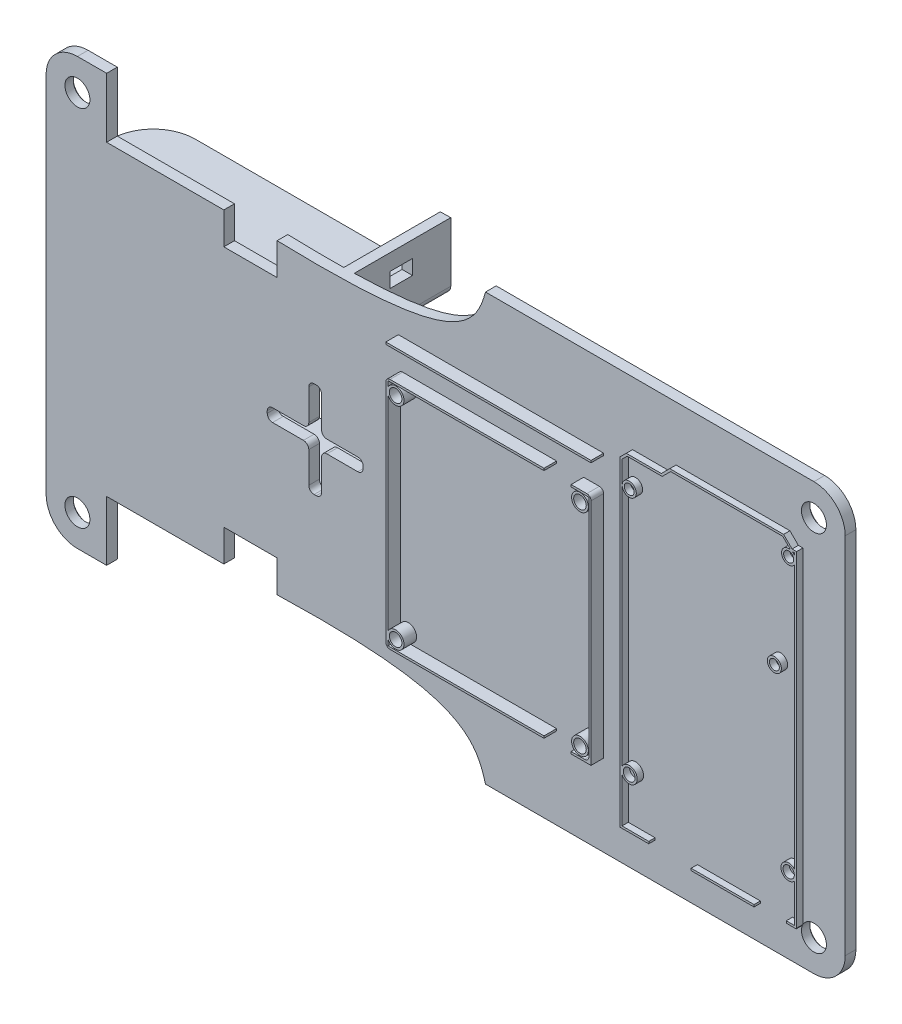
from build123d import *

# Parameters (mm, degrees)
SKETCH1_W                                  = 190.5
SKETCH1_H                                  = 101.6
BOSS_EXTRUDE1_DEPTH                        = 2.54
CUT_EXTRUDE1_DEPTH                         = 108.979878218
FILLET1_R                                  = 7.46
CUT_EXTRUDE2_DEPTH                         = 108.979878356
BOSS_EXTRUDE2_DEPTH                        = 23
SKETCH6_W                                  = 5.32067848
SKETCH6_H                                  = 3.518384052
CUT_EXTRUDE4_DEPTH                         = 132.98228537
FILLET3_R                                  = 1.778
SKETCH5_R                                  = 3.175
CUT_EXTRUDE3_DEPTH                         = 129.654217872
SKETCH7_R                                  = 1.905
SKETCH7_W                                  = 22.4
SKETCH7_H                                  = 22.4
SKETCH7_R_2                                = 3.00715076
BOSS_EXTRUDE4_DEPTH                        = 2.54
SKETCH9_R                                  = 1.397
CUT_EXTRUDE5_DEPTH                         = 1.27
EXTRUDE_THIN1_OUTLINE_R                    = 1.683258174
EXTRUDE_THIN1_OUTLINE_R_2                  = 1.183258174
EXTRUDE_THIN1_OUTLINE_R_3                  = 1.678128829
EXTRUDE_THIN1_OUTLINE_R_4                  = 1.178128829
EXTRUDE_THIN1_OUTLINE_W                    = 14.997012947
EXTRUDE_THIN1_OUTLINE_H                    = 0.5
EXTRUDE_THIN1_OUTLINE_R_5                  = 1.416116328
EXTRUDE_THIN1_OUTLINE_R_6                  = 1.354095782
EXTRUDE_THIN1_OUTLINE_R_7                  = 1.201329703
EXTRUDE_THIN1_DEPTH                        = 1.5
F_15_64_0_23438_DIAMETER_HOLE1_D           = 5.953252
F_15_64_0_23438_DIAMETER_HOLE1_CSINK_D     = 7.223252
F_15_64_0_23438_DIAMETER_HOLE1_CSINK_ANGLE = 100
EXTRUDE_THIN2_OUTLINE_W                    = 48.917101996
EXTRUDE_THIN2_OUTLINE_H                    = 0.5
EXTRUDE_THIN2_OUTLINE_R                    = 1.5
EXTRUDE_THIN2_OUTLINE_R_2                  = 2
EXTRUDE_THIN2_DEPTH                        = 3
FILLET4_R                                  = 1
FILLET5_R                                  = 10
FILLET6_R                                  = 2


# Read off the part's stored shape, not the designer's step: Extrude-Thin1, Extrude-Thin2
with BuildPart() as part:
    # Sketch1 → Boss-Extrude1 (new body)
    with BuildSketch(Plane.XY):
        Rectangle(SKETCH1_W, SKETCH1_H)
    extrude(amount=BOSS_EXTRUDE1_DEPTH)

    # Sketch2 → Cut-Extrude1 (cut, through all)
    with BuildSketch(Plane.XY.offset(2.54)):
        with BuildLine():
            Line((-80.828024073, 62.685762119), (-80.828024073, 36.556311377))
            Line((-80.828024073, 36.556311377), (-52.888024073, 36.556311377))
            Line((-52.888024073, 36.556311377), (-52.888024073, 28.936311377))
            Line((-52.888024073, 28.936311377), (-40.188024073, 28.936311377))
            Line((-40.188024073, 28.936311377), (-40.188024073, 36.556311377))
            add(Edge.make_bspline(
                [(-40.188024073, 36.556311377), (16.484036857, 34.92619245), (6.482116837, 46.779443168), (12.522491122, 62.685762119)],
                knots=[0, 0, 0, 0, 0.808428904, 0.808428904, 0.808428904, 0.808428904], degree=3))
            Line((12.522491122, 62.685762119), (-80.828024073, 62.685762119))
        make_face()
    cut_extrude1 = extrude(amount=-CUT_EXTRUDE1_DEPTH, mode=Mode.SUBTRACT)

    # Mirror1: Cut-Extrude1 across plane
    add(cut_extrude1.mirror(Plane.ZX), mode=Mode.SUBTRACT)

    # Fillet1
    fillet1_edges = [part.edges().sort_by_distance(p)[0] for p in [
        (-95.25, 50.8, 1.27),
        (95.25, 50.8, 1.27),
        (95.25, -50.8, 1.27),
        (-95.25, -50.8, 1.27),
    ]]
    fillet(fillet1_edges, radius=FILLET1_R)

    # Sketch3 → Cut-Extrude2 (cut, through all)
    with BuildSketch(Plane(origin=(0, 0, 0), x_dir=(-1, 0, 0), z_dir=(0, 0, -1))):
        with BuildLine():
            Line((32.633416048, 2.794), (32.633416048, 10.16))
            ThreePointArc((32.633416048, 10.16), (32.26144166, 11.058025612), (31.363416048, 11.43))
            Line((31.363416048, 11.43), (30.855416048, 11.43))
            ThreePointArc((30.855416048, 11.43), (29.957390436, 11.058025612), (29.585416048, 10.16))
            Line((29.585416048, 10.16), (29.585416048, 2.794))
            ThreePointArc((29.585416048, 2.794), (29.21344166, 1.895974388), (28.315416048, 1.524))
            Line((28.315416048, 1.524), (20.949416048, 1.524))
            ThreePointArc((20.949416048, 1.524), (20.051390436, 1.152025612), (19.679416048, 0.254))
            Line((19.679416048, 0.254), (19.679416048, -0.254))
            ThreePointArc((19.679416048, -0.254), (20.051390436, -1.152025612), (20.949416048, -1.524))
            Line((20.949416048, -1.524), (28.315416048, -1.524))
            ThreePointArc((28.315416048, -1.524), (29.21344166, -1.895974388), (29.585416048, -2.794))
            Line((29.585416048, -2.794), (29.585416048, -10.16))
            ThreePointArc((29.585416048, -10.16), (29.957390436, -11.058025612), (30.855416048, -11.43))
            Line((30.855416048, -11.43), (31.363416048, -11.43))
            ThreePointArc((31.363416048, -11.43), (32.26144166, -11.058025612), (32.633416048, -10.16))
            Line((32.633416048, -10.16), (32.633416048, -2.794))
            ThreePointArc((32.633416048, -2.794), (33.005390436, -1.895974388), (33.903416048, -1.524))
            Line((33.903416048, -1.524), (41.269416048, -1.524))
            ThreePointArc((41.269416048, -1.524), (42.16744166, -1.152025612), (42.539416048, -0.254))
            Line((42.539416048, -0.254), (42.539416048, 0.254))
            ThreePointArc((42.539416048, 0.254), (42.16744166, 1.152025612), (41.269416048, 1.524))
            Line((41.269416048, 1.524), (33.903416048, 1.524))
            ThreePointArc((33.903416048, 1.524), (33.005390436, 1.895974388), (32.633416048, 2.794))
        make_face()
    extrude(amount=-CUT_EXTRUDE2_DEPTH, mode=Mode.SUBTRACT)

    # Sketch4 → Boss-Extrude2 (add)
    with BuildSketch(Plane(origin=(0, 0, 0), x_dir=(-1, 0, 0), z_dir=(0, 0, -1))):
        with BuildLine():
            add(Edge.make_bspline(
                [(26.830619379, 36.431168354), (25.975127906, 36.443330167), (25.140496739, 36.459933722), (24.326182366, 36.480917053)],
                knots=[0.07048369, 0.07048369, 0.07048369, 0.07048369, 0.085625626, 0.085625626, 0.085625626, 0.085625626], degree=3))
            Line((24.326182366, 36.480917053), (24.326182366, 20.536114351))
            Line((24.326182366, 20.536114351), (95.25, 20.536114351))
            Line((95.25, 20.536114351), (95.25, 22.233100208))
            Line((95.25, 22.233100208), (26.830619379, 22.233100208))
            Line((26.830619379, 22.233100208), (26.830619379, 36.431168354))
        make_face()
    boss_extrude2 = extrude(amount=BOSS_EXTRUDE2_DEPTH)

    # Sketch6 → Cut-Extrude4 (cut, through all)
    with BuildSketch(Plane(origin=(-24.326182366, 1.013555479, -2.114222725), x_dir=(0, 0, -1), z_dir=(1, 0, 0))):
        with Locations((9.110349708, 29.830937953)):
            Rectangle(SKETCH6_W, SKETCH6_H)
    cut_extrude4 = extrude(amount=-CUT_EXTRUDE4_DEPTH, mode=Mode.SUBTRACT)

    # Fillet3
    fillet3_edges = [part.edges().sort_by_distance(p)[0] for p in [
        (-26.830619379, 22.233100208, -11.5),
        (-24.326182366, 20.536114351, -11.5),
    ]]
    fillet(fillet3_edges, radius=FILLET3_R)

    # Mirror3: Boss-Extrude2, Cut-Extrude4 across plane
    add(boss_extrude2.mirror(Plane.ZX))
    add(cut_extrude4.mirror(Plane.ZX), mode=Mode.SUBTRACT)

    # Sketch5 → Cut-Extrude3 (cut, through all)
    with BuildSketch(Plane(origin=(-3.447719961, 28.936311377, -1.721173464), x_dir=(1, 0, 0), z_dir=(0, 1, 0))):
        with Locations(Location((-35.297381991, 9.740768986, 0), (0, 0, 180))):
            Circle(SKETCH5_R)
    extrude(amount=-CUT_EXTRUDE3_DEPTH, mode=Mode.SUBTRACT)

    # Sketch7 → Boss-Extrude4 (add)
    # profile 1 of 5: a face of its own
    with BuildSketch(Plane(origin=(0, 0, 0), x_dir=(-1, 0, 0), z_dir=(0, 0, -1))):
        with Locations((-40.672123111, 11.2)):
            Circle(SKETCH7_R)
    # profile 2 of 5: a face of its own
    with BuildSketch(Plane(origin=(0, 0, 0), x_dir=(-1, 0, 0), z_dir=(0, 0, -1))):
        with Locations((-63.072123111, -11.2)):
            Circle(SKETCH7_R)
    # profile 3 of 5: a face of its own
    with BuildSketch(Plane(origin=(0, 0, 0), x_dir=(-1, 0, 0), z_dir=(0, 0, -1))):
        with Locations((-40.672123111, -11.2)):
            Circle(SKETCH7_R)
    # profile 4 of 5: a face of its own
    with BuildSketch(Plane(origin=(0, 0, 0), x_dir=(-1, 0, 0), z_dir=(0, 0, -1))):
        with Locations((-63.072123111, 11.2)):
            Circle(SKETCH7_R)
    # profile 5 of 5: a face of its own
    with BuildSketch(Plane(origin=(0, 0, 0), x_dir=(-1, 0, 0), z_dir=(0, 0, -1))):
        with Locations((-51.872123111, 0)):
            Rectangle(SKETCH7_W, SKETCH7_H)
        with Locations((-51.872123111, 0)):
            Circle(SKETCH7_R_2, mode=Mode.SUBTRACT)
    extrude(amount=BOSS_EXTRUDE4_DEPTH)

    # Sketch9 → Cut-Extrude5 (cut)
    with BuildSketch(Plane(origin=(0, 0, -2.54), x_dir=(-1, 0, 0), z_dir=(0, 0, -1))):
        with Locations((-63.072123111, 11.2)):
            Circle(SKETCH9_R)
        with Locations((-40.672123111, 11.2)):
            Circle(SKETCH9_R)
        with Locations(Location((-40.672123111, -11.2, 0), (0, 0, 180))):
            Circle(SKETCH9_R)
        with Locations(Location((-63.072123111, -11.2, 0), (0, 0, 180))):
            Circle(SKETCH9_R)
    extrude(amount=-CUT_EXTRUDE5_DEPTH, mode=Mode.SUBTRACT)

    # Extrude-Thin1 outline → Extrude-Thin1 (add)
    # profile 1 of 4: a face of its own
    with BuildSketch(Plane.XY.offset(2.54)):
        with Locations((45.257226146, 28.716934309)):
            Circle(EXTRUDE_THIN1_OUTLINE_R)
        with Locations((45.257226146, 28.716934309)):
            Circle(EXTRUDE_THIN1_OUTLINE_R_2, mode=Mode.SUBTRACT)
    # profile 2 of 4: a face of its own
    with BuildSketch(Plane.XY.offset(2.54)):
        with Locations((79.858701329, 9.80472822)):
            Circle(EXTRUDE_THIN1_OUTLINE_R_3)
        with Locations((79.858701329, 9.80472822)):
            Circle(EXTRUDE_THIN1_OUTLINE_R_4, mode=Mode.SUBTRACT)
    # profile 3 of 4: a face of its own
    with BuildSketch(Plane.XY.offset(2.54)):
        with Locations((67.512993287, -42.405649433)):
            Rectangle(EXTRUDE_THIN1_OUTLINE_W, EXTRUDE_THIN1_OUTLINE_H)
    # profile 4 of 4: a face of its own
    with BuildSketch(Plane.XY.offset(2.54)):
        with BuildLine():
            Line((43.543889153, -29.347814781), (43.543889153, 34.071918563))
            Line((43.543889153, 34.071918563), (44.759371053, 35.287400463))
            Line((44.759371053, 35.287400463), (53.118794315, 35.287400463))
            Line((53.118794315, 35.287400463), (55.128901393, 37.29750754))
            Line((55.128901393, 37.29750754), (81.861101077, 37.29750754))
            Line((81.861101077, 37.29750754), (83.73804513, 35.420563488))
            ThreePointArc((83.73804513, 35.420563488), (81.662880953, 33.225391142), (84.652760011, 32.794448909))
            Line((84.652760011, 32.794448909), (84.652760011, -30.035570081))
            ThreePointArc((84.652760011, -30.035570081), (81.41544178, -31.270222594), (84.652760011, -32.504875106))
            Line((84.652760011, -32.504875106), (84.652760011, -41.655649433))
            Line((84.652760011, -41.655649433), (82.709966406, -41.655649433))
            Line((82.709966406, -41.655649433), (82.709966406, -42.155649433))
            Line((82.709966406, -42.155649433), (85.152760011, -42.155649433))
            Line((85.152760011, -42.155649433), (85.152760011, 35.787400463))
            Line((85.152760011, 35.787400463), (84.078314936, 35.787400463))
            Line((84.078314936, 35.787400463), (82.068207859, 37.79750754))
            Line((82.068207859, 37.79750754), (54.921794611, 37.79750754))
            Line((54.921794611, 37.79750754), (52.911687534, 35.787400463))
            Line((52.911687534, 35.787400463), (44.552264272, 35.787400463))
            Line((44.552264272, 35.787400463), (43.043889153, 34.279025344))
            Line((43.043889153, 34.279025344), (43.043889153, -42.155649433))
            Line((43.043889153, -42.155649433), (49.916498095, -42.155649433))
            Line((49.916498095, -42.155649433), (49.916498095, -41.655649433))
            Line((49.916498095, -41.655649433), (43.543889153, -41.655649433))
            Line((43.543889153, -41.655649433), (43.543889153, -31.063598137))
            ThreePointArc((43.543889153, -31.063598137), (47.173342474, -30.205706459), (43.543889153, -29.347814781))
        make_face()
        with Locations((45.257226146, -30.205706459)):
            Circle(EXTRUDE_THIN1_OUTLINE_R_5, mode=Mode.SUBTRACT)
        with Locations((83.269537562, -31.270222594)):
            Circle(EXTRUDE_THIN1_OUTLINE_R_6, mode=Mode.SUBTRACT)
        with Locations((83.269537562, 33.785013605)):
            Circle(EXTRUDE_THIN1_OUTLINE_R_7, mode=Mode.SUBTRACT)
        with BuildLine():
            Line((84.067883658, 35.287400463), (84.652760011, 35.287400463))
            Line((84.652760011, 35.287400463), (84.652760011, 34.775578301))
            ThreePointArc((84.652760011, 34.775578301), (84.389939638, 35.065334639), (84.067883658, 35.287400463))
        make_face(mode=Mode.SUBTRACT)
    extrude(amount=EXTRUDE_THIN1_DEPTH)

    # 15/64 (0.23438) Diameter Hole1 (through all)
    with Locations(Plane(origin=(-87.79, 43.34, 0), x_dir=(-1, 0, 0), z_dir=(0, 0, -1))):
        with Locations((0, 0), (0, -86.68), (-175.58, -86.68), (-175.58, 0)):
            CounterSinkHole(F_15_64_0_23438_DIAMETER_HOLE1_D / 2, F_15_64_0_23438_DIAMETER_HOLE1_CSINK_D / 2, counter_sink_angle=F_15_64_0_23438_DIAMETER_HOLE1_CSINK_ANGLE)

    # Extrude-Thin2 outline → Extrude-Thin2 (add)
    # profile 1 of 5: a face of its own
    with BuildSketch(Plane.XY.offset(2.54)):
        with Locations((13.187416506, 31.353987254)):
            Rectangle(EXTRUDE_THIN2_OUTLINE_W, EXTRUDE_THIN2_OUTLINE_H)
    # profile 2 of 5: a face of its own
    with BuildSketch(Plane.XY.offset(2.54)):
        Polygon((32.892054384, -31.363054506), (37.645967504, -31.363054506), (37.645967504, 24.254636664), (32.892054384, 24.254636664), (32.892054384, 23.754636664), (37.145967504, 23.754636664), (37.145967504, -30.863054506), (32.892054384, -30.863054506), align=None)
    # profile 3 of 5: a face of its own
    with BuildSketch(Plane.XY.offset(2.54)):
        with BuildLine():
            Line((-10.752573461, -27.825747299), (-10.769903765, 20.913839174))
            ThreePointArc((-10.769903765, 20.913839174), (-6.932705635, 21.704931592), (-10.770465372, 22.493295026))
            Line((-10.770465372, 22.493295026), (-10.770956739, 23.875213199))
            Line((-10.770956739, 23.875213199), (26.439970442, 23.888444265))
            Line((26.439970442, 23.888444265), (26.439792657, 24.388444234))
            Line((26.439792657, 24.388444234), (-11.271134492, 24.375035382))
            Line((-11.271134492, 24.375035382), (-11.251315734, -31.363054506))
            Line((-11.251315734, -31.363054506), (26.440025251, -31.363054506))
            Line((26.440025251, -31.363054506), (26.440025251, -30.863054506))
            Line((26.440025251, -30.863054506), (-10.751493487, -30.863054506))
            Line((-10.751493487, -30.863054506), (-10.751983107, -29.486053788))
            ThreePointArc((-10.751983107, -29.486053788), (-6.932705635, -28.654542421), (-10.752573461, -27.825747299))
        make_face()
        with Locations((-8.932705508, -28.655253559)):
            Circle(EXTRUDE_THIN2_OUTLINE_R, mode=Mode.SUBTRACT)
        with Locations((-8.932705508, 21.704220452)):
            Circle(EXTRUDE_THIN2_OUTLINE_R, mode=Mode.SUBTRACT)
    # profile 4 of 5: a face of its own
    with BuildSketch(Plane.XY.offset(2.54)):
        with Locations((35.016748718, 21.704220452)):
            Circle(EXTRUDE_THIN2_OUTLINE_R_2)
        with Locations((35.016748718, 21.704220452)):
            Circle(EXTRUDE_THIN2_OUTLINE_R, mode=Mode.SUBTRACT)
    # profile 5 of 5: a face of its own
    with BuildSketch(Plane.XY.offset(2.54)):
        with Locations((35.016748718, -28.655253559)):
            Circle(EXTRUDE_THIN2_OUTLINE_R_2)
        with Locations((35.016748718, -28.655253559)):
            Circle(EXTRUDE_THIN2_OUTLINE_R, mode=Mode.SUBTRACT)
    extrude(amount=EXTRUDE_THIN2_DEPTH)

    # Fillet4
    fillet4_edges = [part.edges().sort_by_distance(p)[0] for p in [
        (-11.271134492, 24.375035382, 4.04),
        (-11.251315734, -31.363054506, 4.04),
        (37.145967504, -30.863054506, 4.04),
        (37.645967504, 24.254636664, 4.04),
    ]]
    fillet(fillet4_edges, radius=FILLET4_R)

    # Fillet5
    fillet5_edges = [part.edges().sort_by_distance(p)[0] for p in [
        (-95.25, 21.384607279, -23),
        (-95.25, -21.384607279, -23),
    ]]
    fillet(fillet5_edges, radius=FILLET5_R)

    # Fillet6
    fillet6_edges = [part.edges().sort_by_distance(p)[0] for p in [
        (-24.326182366, -20.536114351, -11.5),
    ]]
    fillet(fillet6_edges, radius=FILLET6_R)


solid = part.part
